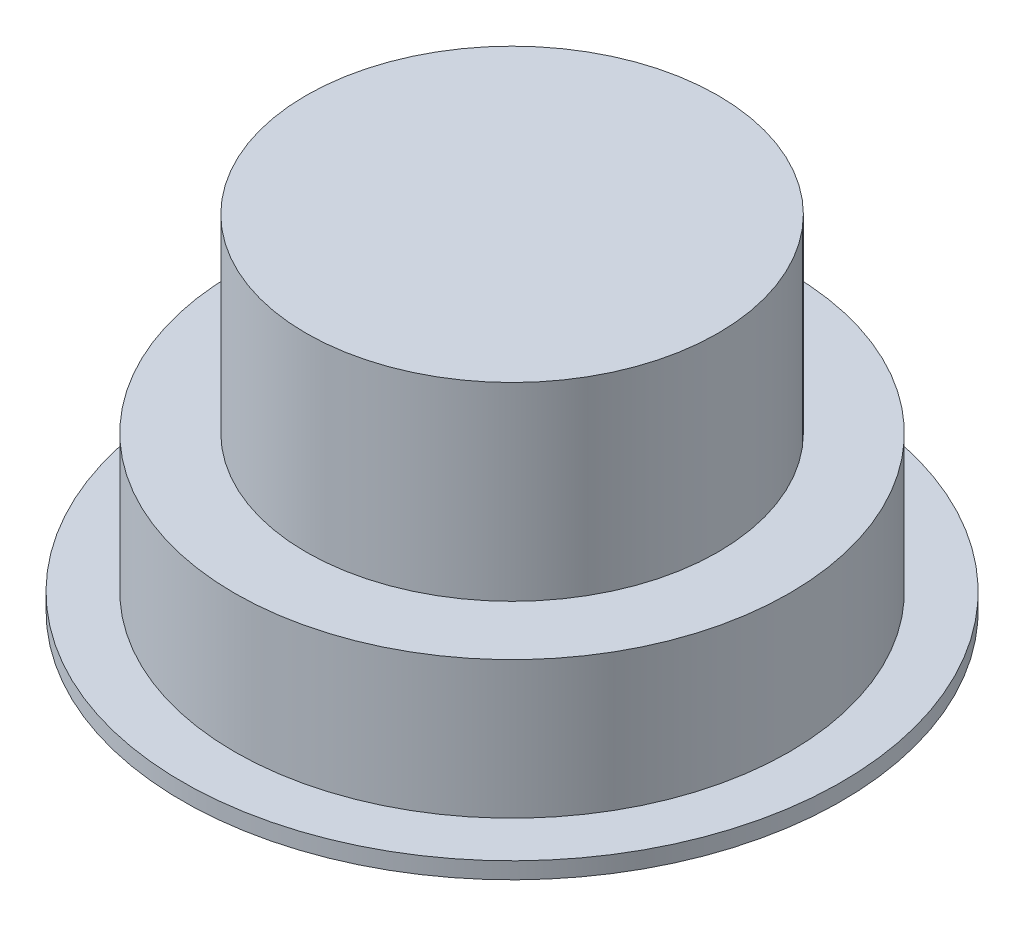
from build123d import *

# Parameters (mm, degrees)
ESQUISSE1_R             = 7.5
BOSS_EXTRU_1_DEPTH      = 10.5
BOSS_EXTRU_2_DEPTH      = 2
BOSS_EXTRU_2_DEPTH_BACK = 3.6
ESQUISSE2_R             = 10.1
ESQUISSE3_R             = 4.75
ENL_V_MAT_EXTRU_2_DEPTH = 6.999999999999999
ESQUISSE4_R             = 2.9
BOSS_EXTRU_3_DEPTH      = 6
CHANFREIN1_SIZE         = 3.75
CHANFREIN1_SIZE_2       = 7.5
ESQUISSE11_R            = 1.25
ENL_V_MAT_EXTRU_4_DEPTH = 7.5
ESQUISSE29_R            = 12
ESQUISSE29_R_2          = 10.1
BOSS_EXTRU_11_DEPTH     = 0.6
CONG_1_R                = 2


with BuildPart() as part:
    # Esquisse1 → Boss.-Extru.1 (new body)
    with BuildSketch(Plane(origin=(0, 0, 0), x_dir=(1, 0, 0), z_dir=(0, 1, 0))):
        with Locations(Location((0, 0, 0), (0, 0, 90))):
            Circle(ESQUISSE1_R)
    extrude(amount=BOSS_EXTRU_1_DEPTH)

    # Esquisse2 → Boss.-Extru.2 (add, two sides: drawn at the far end of the back side and taken through both)
    with BuildSketch(Plane.XZ.offset(-BOSS_EXTRU_2_DEPTH_BACK)):
        with Locations(Location((0, 0, 0), (0, 0, 270))):
            Circle(ESQUISSE2_R)
    extrude(amount=BOSS_EXTRU_2_DEPTH + BOSS_EXTRU_2_DEPTH_BACK)

    # Esquisse3 → Enlèv. mat.-Extru.2 (cut)
    with BuildSketch(Plane.XZ.offset(2)):
        with Locations(Location((0, 0, 0), (0, 0, 270))):
            Circle(ESQUISSE3_R)
    extrude(amount=-ENL_V_MAT_EXTRU_2_DEPTH, mode=Mode.SUBTRACT)

    # Esquisse4 → Boss.-Extru.3 (add)
    with BuildSketch(Plane.XZ.offset(-4.999999999999999)):
        with Locations(Location((0, 0, 0), (0, 0, 270))):
            Circle(ESQUISSE4_R)
    extrude(amount=BOSS_EXTRU_3_DEPTH)

    # Chanfrein1
    # the kernel refuses this chamfer: 7.5, 3.75 mm, written as the material it takes off along each edge
    with BuildSketch(Plane(origin=(0, -2, 0), x_dir=(-1.8e-16, 0, -1), z_dir=(-1, 0, 1.8e-16))) as chanfrein1_piece_1_section:
        Polygon((4.75 + CHANFREIN1_SIZE, 0), (4.75, -CHANFREIN1_SIZE_2), (4.75, 0), align=None)
    chanfrein1_piece_1 = revolve(axis=Axis((0, -2, 0), (0, -1, 0)), mode=Mode.PRIVATE)
    chanfrein1_piece_1 = split(chanfrein1_piece_1, bisect_by=Plane(origin=(2.06e-15, 4.999999999999999, 6.741862305399), z_dir=(0, -1, 0)), keep=Keep.TOP, mode=Mode.PRIVATE)
    add(chanfrein1_piece_1, mode=Mode.SUBTRACT)

    # Esquisse11 → Enlèv. mat.-Extru.4 (cut)
    with BuildSketch(Plane.XZ.offset(1.0000000000000009)):
        with Locations(Location((0, 0, 0), (0, 0, 270))):
            Circle(ESQUISSE11_R)
    extrude(amount=-ENL_V_MAT_EXTRU_4_DEPTH, mode=Mode.SUBTRACT)

    # Esquisse29 → Boss.-Extru.11 (add)
    with BuildSketch(Plane.XZ.offset(2)):
        with Locations(Location((0, 0, 0), (0, 0, 270))):
            Circle(ESQUISSE29_R)
        with Locations(Location((0, 0, 0), (0, 0, 270))):
            Circle(ESQUISSE29_R_2, mode=Mode.SUBTRACT)
    extrude(amount=-BOSS_EXTRU_11_DEPTH)

    # Congé1
    # the kernel refuses this fillet: 2 mm, written as the material it takes off along each edge
    with BuildSketch(Plane(origin=(0, -1.0000000000000009, 0), x_dir=(-1.8e-16, 0, -1), z_dir=(-1, 0, 1.8e-16))) as cong_1_piece_1:
        with BuildLine():
            CenterArc((3.25, -1.9691368667519222), CONG_1_R, 100.07865810778567, 79.92134189221433)
            Line((1.25, -1.9691368667519222), (1.21, -1.9691368667519222))
            Line((1.21, -1.9691368667519222), (1.21, 0))
            Line((1.21, 0), (1.25, 0.04000000000000004))
            ThreePointArc((1.25, 0.04000000000000004), (2.0750000000000344, 0.04000000000000004), (2.89300000000007, 0.03938273733464226))
            Line((2.89300000000007, 0.03938273733464226), (2.9000000000000687, -3.8836e-13))
        make_face()
    revolve(axis=Axis((0, -1.0000000000000009, 0), (0, -1, 0)), mode=Mode.SUBTRACT)


solid = part.part
